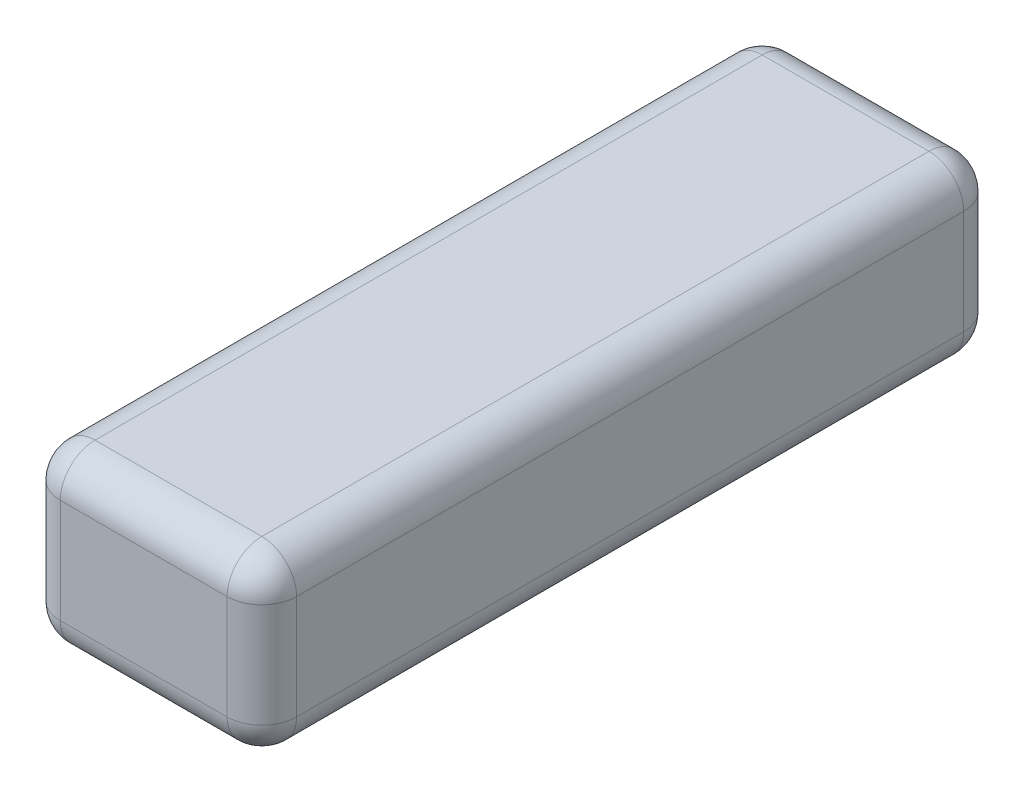
from build123d import *

# Parameters (mm, degrees)
BOSS_EXTRU_1_DEPTH      = 12.5
BOSS_EXTRU_1_DEPTH_BACK = 12.5
ESQUISSE1_W             = 34
ESQUISSE1_H             = 106
CONG_1_R                = 5
CONG_2_R                = 5


with BuildPart() as part:
    # Esquisse1 → Boss.-Extru.1 (new, two sides: drawn at the far end of the back side and taken through both)
    with BuildSketch(Plane(origin=(0, 0, 0), x_dir=(1, 0, 0), z_dir=(0, 1, 0)).offset(-BOSS_EXTRU_1_DEPTH_BACK)):
        Rectangle(ESQUISSE1_W, ESQUISSE1_H)
    extrude(amount=BOSS_EXTRU_1_DEPTH + BOSS_EXTRU_1_DEPTH_BACK)

    # Congé1
    cong_1_edges = [part.edges().sort_by_distance(p)[0] for p in [
        (17, 0, -53),
        (-17, 0, -53),
        (-17, 0, 53),
        (17, 0, 53),
    ]]
    fillet(cong_1_edges, radius=CONG_1_R)

    # Congé2
    cong_2_edges = [part.edges().sort_by_distance(p)[0] for p in [
        (17, -12.5, 0),
        (15.535533906, -12.5, -51.535533906),
        (0, -12.5, -53),
        (-15.535533906, -12.5, -51.535533906),
        (-17, -12.5, 0),
        (-15.535533906, -12.5, 51.535533906),
        (0, -12.5, 53),
        (0, 12.5, 53),
        (-15.535533906, 12.5, 51.535533906),
        (-17, 12.5, 0),
        (-15.535533906, 12.5, -51.535533906),
        (0, 12.5, -53),
        (15.535533906, 12.5, -51.535533906),
        (17, 12.5, 0),
        (15.535533906, -12.5, 51.535533906),
        (15.535533906, 12.5, 51.535533906),
    ]]
    fillet(cong_2_edges, radius=CONG_2_R)


solid = part.part
